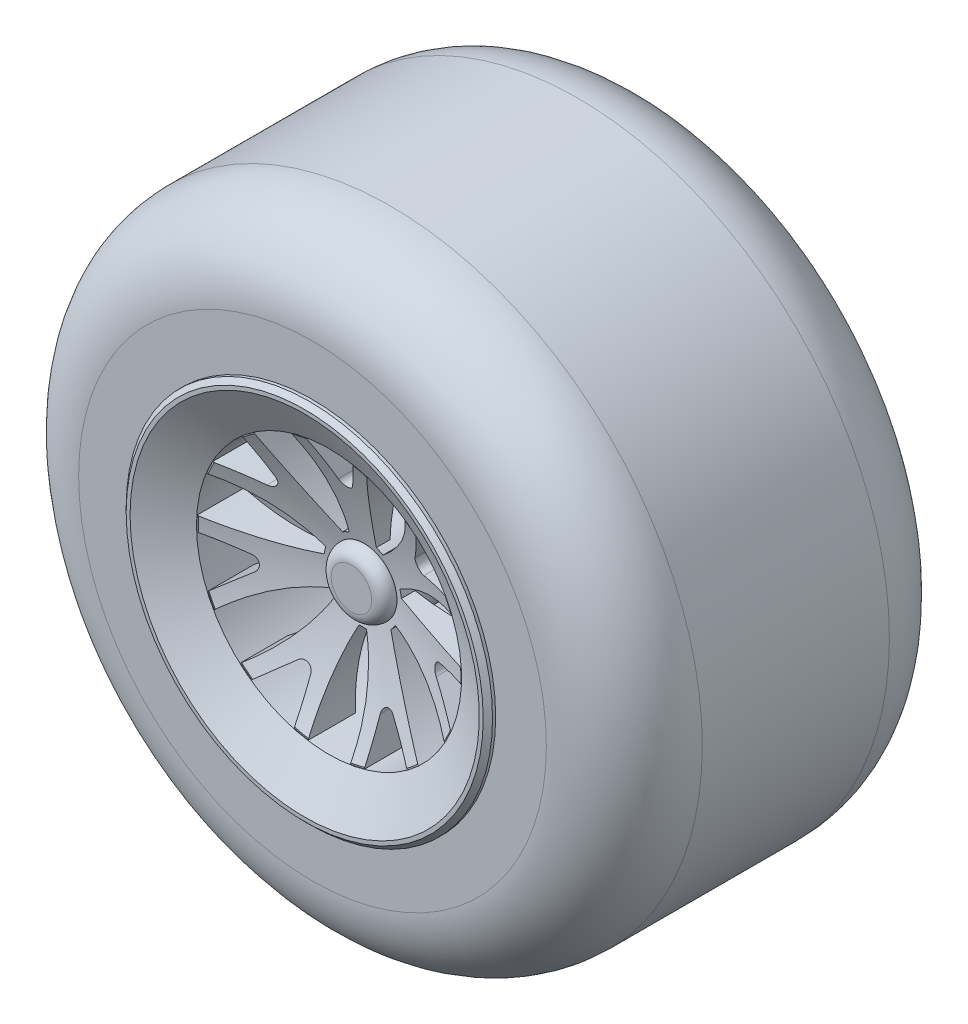
from build123d import *

# Parameters (mm, degrees)
SKETCH2_R               = 8.5
SKETCH2_R_2             = 2.5
CUT_EXTRUDE1_DEPTH      = 37.455452322
CHAMFER1_SIZE           = 0.3
CHAMFER2_SIZE           = 0.3
CHAMFER3_SIZE           = 2.7
CHAMFER3_SIZE2          = 1.558845727
BOSS_EXTRUDE1_START     = -1.6
BOSS_EXTRUDE1_DEPTH     = 3
BOSS_EXTRUDE2_START     = -4
SKETCH5_R               = 2.1
BOSS_EXTRUDE2_DEPTH     = 1
FILLET1_R               = 0.8
CUT_EXTRUDE2_DEPTH      = 37.455452385
CUT_EXTRUDE2_DEPTH_BACK = 37.455452385
SKETCH8_W               = 48.52371923
SKETCH8_H               = 16.245722225
CUT_EXTRUDE3_START      = -5
SKETCH9_R               = 2.1
CUT_EXTRUDE3_DEPTH      = 17


with BuildPart() as part:
    # Sketch1 → Revolve1 (revolve)
    with BuildSketch(Plane(origin=(0, 0, 0), x_dir=(0, 0, -1), z_dir=(1, 0, 0))):
        with BuildLine():
            Line((0, 0), (0, 11.75))
            Line((0, 11.75), (0.5, 11.75))
            Line((0.5, 11.75), (0.5, 15))
            ThreePointArc((0.5, 15), (1.964466094, 18.535533906), (5.5, 20))
            Line((5.5, 20), (17.5, 20))
            ThreePointArc((17.5, 20), (21.035533906, 18.535533906), (22.5, 15))
            Line((22.5, 15), (22.5, 11.75))
            Line((22.5, 11.75), (23, 11.75))
            Line((23, 11.75), (23, 0))
            Line((23, 0), (0, 0))
        make_face()
    revolve(axis=Axis((0, 0, 0), (0, 0, -1)))

    # Sketch2 → Cut-Extrude1 (cut, through all)
    with BuildSketch(Plane.XY):
        Circle(SKETCH2_R)
        Circle(SKETCH2_R_2, mode=Mode.SUBTRACT)
    extrude(amount=-CUT_EXTRUDE1_DEPTH, mode=Mode.SUBTRACT)


with BuildPart() as cut_extrude1_piece_1:
    # of the separate pieces the step leaves, piece 1, a body of its own (cut_extrude1_pieces)
    add(part.part.solids().sort_by_distance((0, 11.75, 0))[0])

    # Chamfer1
    chamfer1_edges = [cut_extrude1_piece_1.edges().sort_by_distance(p)[0] for p in [
        (0, -11.75, 0),
    ]]
    chamfer(chamfer1_edges, length=CHAMFER1_SIZE)

    # Chamfer2
    chamfer2_edges = [cut_extrude1_piece_1.edges().sort_by_distance(p)[0] for p in [
        (0, -11.75, -23),
    ]]
    chamfer(chamfer2_edges, length=CHAMFER2_SIZE)

    # Chamfer3
    chamfer3_edges = [cut_extrude1_piece_1.edges().sort_by_distance(p)[0] for p in [
        (-8.5, 0, 0),
    ]]
    chamfer3_side = [cut_extrude1_piece_1.faces().sort_by_distance(p)[0] for p in [
        (0, -11.126145094, 0),
    ]]
    chamfer(chamfer3_edges, length=CHAMFER3_SIZE, length2=CHAMFER3_SIZE2, reference=chamfer3_side[0])



with BuildPart() as cut_extrude1_piece_2:
    # of the separate pieces the step leaves, piece 2, a body of its own (cut_extrude1_pieces)
    add(part.part.solids().sort_by_distance((2.5, 0, 0))[0])


with BuildPart() as cut_extrude1_piece_1_1:
    add(cut_extrude1_piece_1.part)

    add(cut_extrude1_piece_2.part)  # Boss-Extrude1 merges Cut-Extrude1 piece 2
    # Sketch3 → Boss-Extrude1 (add)
    with BuildSketch(Plane.XY.offset(BOSS_EXTRUDE1_START)):
        with BuildLine():
            ThreePointArc((-0.868283762, 2.34437269), (0, 2.5), (0.868283762, 2.34437269))
            ThreePointArc((0.868283762, 2.34437269), (1.61618822, 6.30463955), (3.508911586, 9.862823489))
            Line((3.508911586, 9.862823489), (2.232608586, 9.862823489))
            add(Edge.make_bspline(
                [(2.232608586, 9.862823489), (1.639265951, 8.59932993), (1.045923317, 7.335836371), (0.452580682, 6.072342812)],
                knots=[0, 0, 0, 0, 0.79728615, 0.79728615, 0.79728615, 0.79728615], degree=3))
            ThreePointArc((0.452580682, 6.072342812), (0, 5.78487687), (-0.452580682, 6.072342812))
            add(Edge.make_bspline(
                [(-2.232608586, 9.862823489), (-1.639265951, 8.59932993), (-1.045923317, 7.335836371), (-0.452580682, 6.072342812)],
                knots=[0, 0, 0, 0, 0.79728615, 0.79728615, 0.79728615, 0.79728615], degree=3))
            Line((-2.232608586, 9.862823489), (-3.508911586, 9.862823489))
            ThreePointArc((-3.508911586, 9.862823489), (-1.61618822, 6.30463955), (-0.868283762, 2.34437269))
        make_face()
        with BuildLine():
            Line((-1.868108514, 0.426383578), (-0.813182871, 1.749218493))
            ThreePointArc((-0.813182871, 1.749218493), (-3.75436479, 4.934518788), (-5.52329532, 8.89274741))
            Line((-5.52329532, 8.89274741), (-6.319057225, 7.894893543))
            add(Edge.make_bspline(
                [(-6.319057225, 7.894893543), (-5.701161264, 6.643224243), (-5.083265303, 5.391554942), (-4.465369343, 4.139885642)],
                knots=[0, 0, 0, 0, 0.79728615, 0.79728615, 0.79728615, 0.79728615], degree=3))
            ThreePointArc((-4.465369343, 4.139885642), (-4.522798859, 3.606811734), (-5.029728222, 3.432201991))
            add(Edge.make_bspline(
                [(-9.103074594, 4.403846182), (-7.74529247, 4.079964785), (-6.387510346, 3.756083388), (-5.029728222, 3.432201991)],
                knots=[0, 0, 0, 0, 0.79728615, 0.79728615, 0.79728615, 0.79728615], degree=3))
            Line((-9.103074594, 4.403846182), (-9.898836499, 3.405992315))
            ThreePointArc((-9.898836499, 3.405992315), (-5.674136846, 2.572625007), (-1.932587507, 0.441100487))
            ThreePointArc((-1.932587507, 0.441100487), (-6.228440807, 0.144060671), (-10.396348195, 1.226251153))
            Line((-10.396348195, 1.226251153), (-10.11234406, -0.018052267))
            add(Edge.make_bspline(
                [(-10.11234406, -0.018052267), (-8.748497765, -0.315364796), (-7.38465147, -0.612677325), (-6.020805175, -0.909989854)],
                knots=[0, 0, 0, 0, 0.79728615, 0.79728615, 0.79728615, 0.79728615], degree=3))
            ThreePointArc((-6.020805175, -0.909989854), (-5.639837929, -1.287256204), (-5.819387823, -1.792456933))
            add(Edge.make_bspline(
                [(-9.118739764, -4.371317121), (-8.018955784, -3.511697059), (-6.919171804, -2.652076996), (-5.819387823, -1.792456933)],
                knots=[0, 0, 0, 0, 0.79728615, 0.79728615, 0.79728615, 0.79728615], degree=3))
            Line((-9.118739764, -4.371317121), (-8.834735629, -5.615620541))
            ThreePointArc((-8.834735629, -5.615620541), (-5.523573257, -2.816889972), (-1.491609912, -1.223164581))
            Line((-1.491609912, -1.223164581), (-1.868108514, 0.426383578))
        make_face()
        with BuildLine():
            ThreePointArc((5.52329532, 8.89274741), (3.921488813, 5.194465296), (1.291538305, 2.140544045))
            ThreePointArc((1.291538305, 2.140544045), (1.954578706, 1.558724505), (2.374270446, 0.782840883))
            ThreePointArc((2.374270446, 0.782840883), (5.936842559, 2.667291632), (9.898836499, 3.405992315))
            Line((9.898836499, 3.405992315), (9.103074594, 4.403846182))
            add(Edge.make_bspline(
                [(9.103074594, 4.403846182), (7.74529247, 4.079964785), (6.387510346, 3.756083388), (5.029728222, 3.432201991)],
                knots=[0, 0, 0, 0, 0.79728615, 0.79728615, 0.79728615, 0.79728615], degree=3))
            ThreePointArc((5.029728222, 3.432201991), (4.522798859, 3.606811734), (4.465369343, 4.139885642))
            add(Edge.make_bspline(
                [(6.319057225, 7.894893543), (5.701161264, 6.643224243), (5.083265303, 5.391554942), (4.465369343, 4.139885642)],
                knots=[0, 0, 0, 0, 0.79728615, 0.79728615, 0.79728615, 0.79728615], degree=3))
            Line((6.319057225, 7.894893543), (5.52329532, 8.89274741))
        make_face()
        with BuildLine():
            ThreePointArc((10.396348195, 1.226251153), (6.506204786, 0.172752726), (2.478805685, 0.324842075))
            ThreePointArc((2.478805685, 0.324842075), (2.43731978, -0.556302335), (2.092383058, -1.368186076))
            ThreePointArc((2.092383058, -1.368186076), (5.786933361, -2.978581288), (8.834735629, -5.615620541))
            Line((8.834735629, -5.615620541), (9.118739764, -4.371317121))
            add(Edge.make_bspline(
                [(9.118739764, -4.371317121), (8.018955784, -3.511697059), (6.919171804, -2.652076996), (5.819387823, -1.792456933)],
                knots=[0, 0, 0, 0, 0.79728615, 0.79728615, 0.79728615, 0.79728615], degree=3))
            ThreePointArc((5.819387823, -1.792456933), (5.639837929, -1.287256204), (6.020805175, -0.909989854))
            add(Edge.make_bspline(
                [(10.11234406, -0.018052267), (8.748497765, -0.315364796), (7.38465147, -0.612677325), (6.020805175, -0.909989854)],
                knots=[0, 0, 0, 0, 0.79728615, 0.79728615, 0.79728615, 0.79728615], degree=3))
            Line((10.11234406, -0.018052267), (10.396348195, 1.226251153))
        make_face()
        with BuildLine():
            ThreePointArc((-0.23488855, -2.488941014), (-1.084709348, -2.25242217), (-1.799481827, -1.735472603))
            ThreePointArc((-1.799481827, -1.735472603), (-4.191615853, -4.97904617), (-7.440738833, -7.363637234))
            Line((-7.440738833, -7.363637234), (-6.290829563, -7.917404352))
            add(Edge.make_bspline(
                [(-6.290829563, -7.917404352), (-5.208037012, -7.036477711), (-4.125244461, -6.15555107), (-3.042451909, -5.27462443)],
                knots=[0, 0, 0, 0, 0.79728615, 0.79728615, 0.79728615, 0.79728615], degree=3))
            ThreePointArc((-3.042451909, -5.27462443), (-2.509964007, -5.211993965), (-2.226929699, -5.667359227))
            add(Edge.make_bspline(
                [(-2.267807903, -9.854789474), (-2.254181835, -8.458979392), (-2.240555767, -7.063169309), (-2.226929699, -5.667359227)],
                knots=[0, 0, 0, 0, 0.79728615, 0.79728615, 0.79728615, 0.79728615], degree=3))
            Line((-2.267807903, -9.854789474), (-1.117898634, -10.408556592))
            ThreePointArc((-1.117898634, -10.408556592), (-1.279345311, -6.381521746), (-0.23488855, -2.488941014))
        make_face()
        with BuildLine():
            ThreePointArc((7.440738833, -7.363637234), (4.191615853, -4.97904617), (1.799481827, -1.735472603))
            ThreePointArc((1.799481827, -1.735472603), (1.084709348, -2.25242217), (0.23488855, -2.488941014))
            ThreePointArc((0.23488855, -2.488941014), (1.279345311, -6.381521746), (1.117898634, -10.408556592))
            Line((1.117898634, -10.408556592), (2.267807903, -9.854789474))
            add(Edge.make_bspline(
                [(2.267807903, -9.854789474), (2.254181835, -8.458979392), (2.240555767, -7.063169309), (2.226929699, -5.667359227)],
                knots=[0, 0, 0, 0, 0.79728615, 0.79728615, 0.79728615, 0.79728615], degree=3))
            ThreePointArc((2.226929699, -5.667359227), (2.509964007, -5.211993965), (3.042451909, -5.27462443))
            add(Edge.make_bspline(
                [(6.290829563, -7.917404352), (5.208037012, -7.036477711), (4.125244461, -6.15555107), (3.042451909, -5.27462443)],
                knots=[0, 0, 0, 0, 0.79728615, 0.79728615, 0.79728615, 0.79728615], degree=3))
            Line((6.290829563, -7.917404352), (7.440738833, -7.363637234))
        make_face()
    extrude(amount=-BOSS_EXTRUDE1_DEPTH)

    # Sketch4 → Cut-Revolve1 (revolve, cut)
    with BuildSketch(Plane(origin=(0, 0, 0), x_dir=(0, 0, -1), z_dir=(1, 0, 0))):
        with BuildLine():
            Line((1.559133982, 8.5), (-2.970996421, 8.5))
            Line((-2.970996421, 8.5), (-2.970996421, 0))
            Line((-2.970996421, 0), (4.192756956, 0))
            add(Edge.make_bspline(
                [(1.559133982, 8.5), (3.608242731, 4.305669633), (4.192756956, 0)],
                knots=[0, 0, 0, 1, 1, 1], degree=2))
        make_face()
    revolve(axis=Axis((0, 0, 2.970996421), (0, 0, -1)), mode=Mode.SUBTRACT)

    # Sketch5 → Boss-Extrude2 (add)
    with BuildSketch(Plane.XY.offset(BOSS_EXTRUDE2_START)):
        Circle(SKETCH5_R)
    extrude(amount=BOSS_EXTRUDE2_DEPTH)

    # Fillet1
    fillet1_edges = [cut_extrude1_piece_1_1.edges().sort_by_distance(p)[0] for p in [
        (-2.1, 0, -3),
    ]]
    fillet(fillet1_edges, radius=FILLET1_R)

    # Sketch8 → Cut-Extrude2 (cut, two sides: drawn at the far end of the back side and taken through both)
    with BuildSketch(Plane(origin=(0, 0, 0), x_dir=(1, 0, 0), z_dir=(0, 1, 0)).offset(-CUT_EXTRUDE2_DEPTH_BACK)):
        with Locations((-1.660146797, 19.622861113)):
            Rectangle(SKETCH8_W, SKETCH8_H)
    extrude(amount=CUT_EXTRUDE2_DEPTH + CUT_EXTRUDE2_DEPTH_BACK, mode=Mode.SUBTRACT)

    # Mirror3: Cut-Extrude1 piece 1 across plane


with BuildPart() as cut_extrude1_piece_1_2:
    add(cut_extrude1_piece_1_1.part)
    add(cut_extrude1_piece_1_1.part.mirror(Plane.XY.offset(-11.5)))

    # Sketch9 → Cut-Extrude3 (cut)
    with BuildSketch(Plane.XY.offset(-11.5).offset(CUT_EXTRUDE3_START)):
        Circle(SKETCH9_R)
    extrude(amount=-CUT_EXTRUDE3_DEPTH, mode=Mode.SUBTRACT)


solid = cut_extrude1_piece_1_2.part
